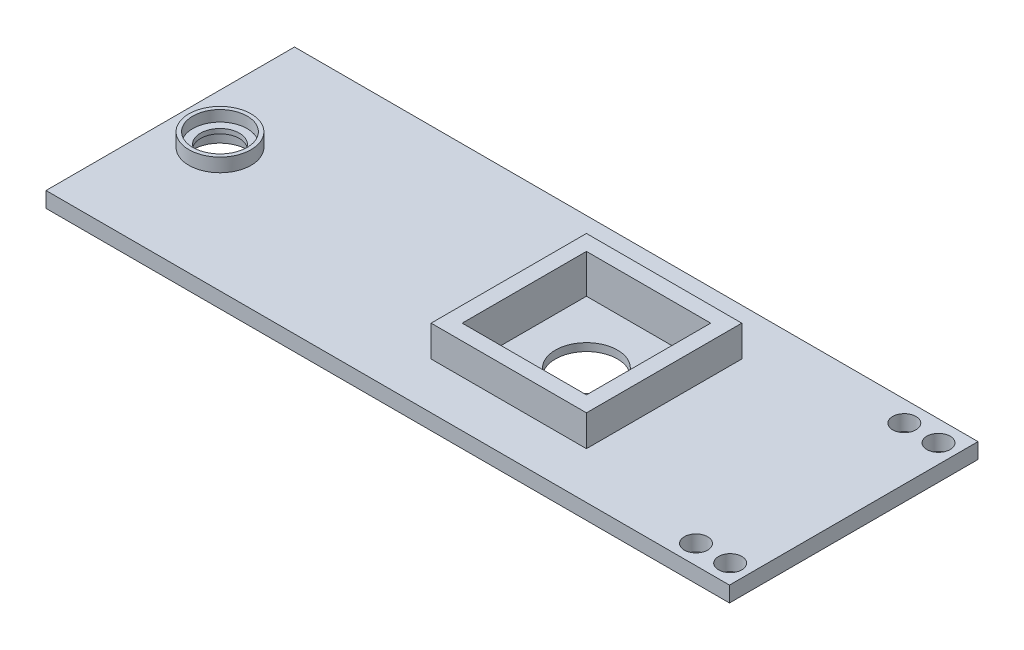
from build123d import *

# Parameters (mm, degrees)
SKETCH1_W           = 279.4
SKETCH1_H           = 101.6
BOSS_EXTRUDE1_DEPTH = 6.35
SKETCH2_R           = 12.7
BOSS_EXTRUDE3_DEPTH = 5.55625
SKETCH9_R           = 11.1125
CUT_EXTRUDE4_DEPTH  = 4.445
CUT_EXTRUDE5_START  = -5.55625
SKETCH10_R          = 11.1125
CUT_EXTRUDE5_DEPTH  = 5.55625
SKETCH11_R          = 7.9375
CUT_EXTRUDE6_DEPTH  = 310.094403462
SKETCH12_R          = 12.7
CUT_EXTRUDE7_DEPTH  = 310.0695755
SKETCH22_W          = 63.5
SKETCH22_H          = 63.5
BOSS_EXTRUDE7_DEPTH = 12.7
SKETCH25_W          = 50.8
SKETCH25_H          = 50.8
CUT_EXTRUDE11_DEPTH = 15.875
SKETCH32_R          = 4.7625
CUT_EXTRUDE12_DEPTH = 6.35


with BuildPart() as part:
    # Sketch1 → Boss-Extrude1 (new body)
    with BuildSketch(Plane(origin=(0, 0, 0), x_dir=(1, 0, 0), z_dir=(0, 1, 0))):
        with Locations((-165.1, 0)):
            Rectangle(SKETCH1_W, SKETCH1_H)
    extrude(amount=BOSS_EXTRUDE1_DEPTH)

    # Sketch2 → Boss-Extrude3 (add)
    with BuildSketch(Plane(origin=(0, 6.35, 0), x_dir=(1, 0, 0), z_dir=(0, 1, 0))):
        with Locations((-284.48, 0)):
            Circle(SKETCH2_R)
    extrude(amount=BOSS_EXTRUDE3_DEPTH)

    # Sketch9 → Cut-Extrude4 (cut)
    with BuildSketch(Plane(origin=(0, 11.90625, 0), x_dir=(1, 0, 0), z_dir=(0, 1, 0))):
        with Locations((-284.48, 0)):
            Circle(SKETCH9_R)
    extrude(amount=-CUT_EXTRUDE4_DEPTH, mode=Mode.SUBTRACT)

    # Sketch10 → Cut-Extrude5 (cut)
    with BuildSketch(Plane(origin=(0, 0, 0), x_dir=(-1, 0, 0), z_dir=(0, -1, 0)).offset(CUT_EXTRUDE5_START)):
        with Locations((284.48, 0)):
            Circle(SKETCH10_R)
    extrude(amount=CUT_EXTRUDE5_DEPTH, mode=Mode.SUBTRACT)

    # Sketch11 → Cut-Extrude6 (cut, through all)
    with BuildSketch(Plane(origin=(0, 7.46125, 0), x_dir=(1, 0, 0), z_dir=(0, 1, 0))):
        with Locations((-284.48, 0)):
            Circle(SKETCH11_R)
    extrude(amount=-CUT_EXTRUDE6_DEPTH, mode=Mode.SUBTRACT)

    # Sketch12 → Cut-Extrude7 (cut, through all)
    with BuildSketch(Plane(origin=(0, 6.35, 0), x_dir=(1, 0, 0), z_dir=(0, 1, 0))):
        with Locations((-134.666203771, 0)):
            Circle(SKETCH12_R)
    extrude(amount=-CUT_EXTRUDE7_DEPTH, mode=Mode.SUBTRACT)

    # Sketch22 → Boss-Extrude7 (add)
    with BuildSketch(Plane(origin=(0, 6.35, 0), x_dir=(1, 0, 0), z_dir=(0, 1, 0))):
        with Locations((-134.666203771, 0)):
            Rectangle(SKETCH22_W, SKETCH22_H)
    extrude(amount=BOSS_EXTRUDE7_DEPTH)

    # Sketch25 → Cut-Extrude11 (cut)
    with BuildSketch(Plane(origin=(0, 19.05, 0), x_dir=(1, 0, 0), z_dir=(0, 1, 0))):
        with Locations((-134.666203771, 0)):
            Rectangle(SKETCH25_W, SKETCH25_H)
    extrude(amount=-CUT_EXTRUDE11_DEPTH, mode=Mode.SUBTRACT)

    # Sketch32 → Cut-Extrude12 (cut)
    with BuildSketch(Plane(origin=(0, 6.35, 0), x_dir=(1, 0, 0), z_dir=(0, 1, 0))):
        with Locations((-33.02, -42.893773539)):
            Circle(SKETCH32_R)
        with Locations((-46.99, -42.893773539)):
            Circle(SKETCH32_R)
        with Locations((-33.02, 42.272941973)):
            Circle(SKETCH32_R)
        with Locations((-46.99, 42.272941973)):
            Circle(SKETCH32_R)
    extrude(amount=-CUT_EXTRUDE12_DEPTH, mode=Mode.SUBTRACT)


solid = part.part
